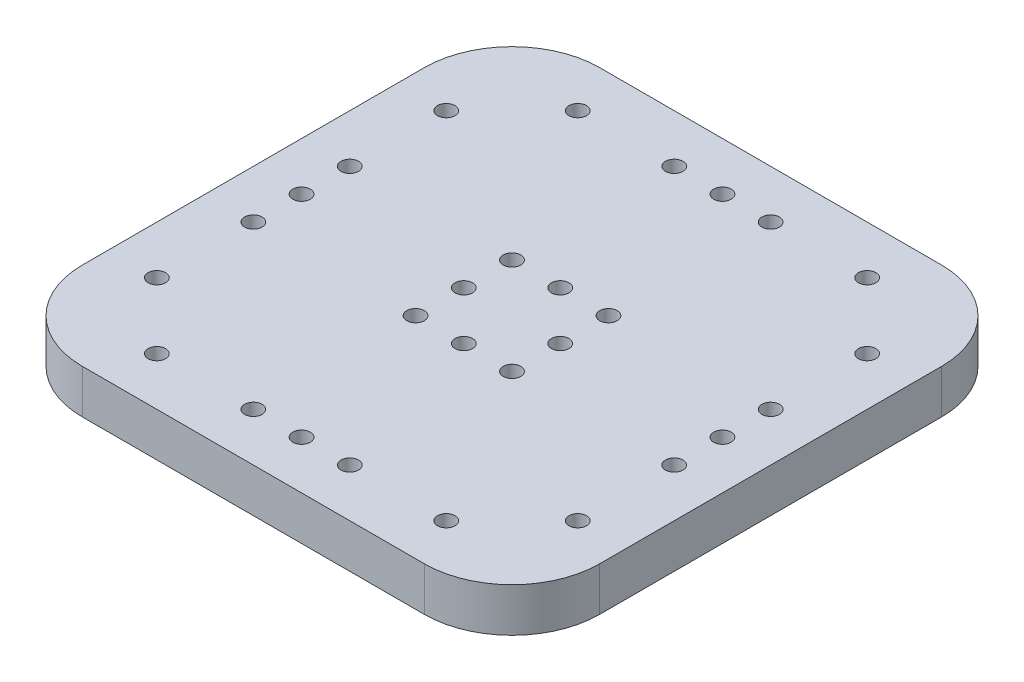
from build123d import *

# Parameters (mm, degrees)
SKETCH1_W           = 118
SKETCH1_H           = 118
SKETCH1_R           = 2
BOSS_EXTRUDE1_DEPTH = 10
FILLET1_R           = 20


with BuildPart() as part:
    # Sketch1 → Boss-Extrude1 (new body)
    with BuildSketch(Plane(origin=(0, 0, 0), x_dir=(1, 0, 0), z_dir=(0, 1, 0))):
        with Locations((-1.371006445, 1.121732546)):
            Rectangle(SKETCH1_W, SKETCH1_H)
        with Locations((-1.371006445, -46.878267454)):
            Circle(SKETCH1_R, mode=Mode.SUBTRACT)
        with Locations((9.628993555, -46.878267454)):
            Circle(SKETCH1_R, mode=Mode.SUBTRACT)
        with Locations((31.628993555, -46.878267454)):
            Circle(SKETCH1_R, mode=Mode.SUBTRACT)
        with Locations((-34.371006445, -46.878267454)):
            Circle(SKETCH1_R, mode=Mode.SUBTRACT)
        with Locations((-12.371006445, -46.878267454)):
            Circle(SKETCH1_R, mode=Mode.SUBTRACT)
        with Locations((-1.371006445, -9.878267454)):
            Circle(SKETCH1_R, mode=Mode.SUBTRACT)
        with Locations((9.628993555, -9.878267454)):
            Circle(SKETCH1_R, mode=Mode.SUBTRACT)
        with Locations((-12.371006445, -9.878267454)):
            Circle(SKETCH1_R, mode=Mode.SUBTRACT)
        with Locations((-12.371006445, 1.121732546)):
            Circle(SKETCH1_R, mode=Mode.SUBTRACT)
        with Locations((-12.371006445, 12.121732546)):
            Circle(SKETCH1_R, mode=Mode.SUBTRACT)
        with Locations((9.628993555, 12.121732546)):
            Circle(SKETCH1_R, mode=Mode.SUBTRACT)
        with Locations((-1.371006445, 12.121732546)):
            Circle(SKETCH1_R, mode=Mode.SUBTRACT)
        with Locations((-12.371006445, 49.121732546)):
            Circle(SKETCH1_R, mode=Mode.SUBTRACT)
        with Locations((-34.371006445, 49.121732546)):
            Circle(SKETCH1_R, mode=Mode.SUBTRACT)
        with Locations((31.628993555, 49.121732546)):
            Circle(SKETCH1_R, mode=Mode.SUBTRACT)
        with Locations((9.628993555, 49.121732546)):
            Circle(SKETCH1_R, mode=Mode.SUBTRACT)
        with Locations((-1.371006445, 49.121732546)):
            Circle(SKETCH1_R, mode=Mode.SUBTRACT)
        with Locations((9.628993555, 1.121732546)):
            Circle(SKETCH1_R, mode=Mode.SUBTRACT)
        with Locations((46.628993555, 12.121732546)):
            Circle(SKETCH1_R, mode=Mode.SUBTRACT)
        with Locations((46.628993555, 34.121732546)):
            Circle(SKETCH1_R, mode=Mode.SUBTRACT)
        with Locations((46.628993555, -31.878267454)):
            Circle(SKETCH1_R, mode=Mode.SUBTRACT)
        with Locations((46.628993555, -9.878267454)):
            Circle(SKETCH1_R, mode=Mode.SUBTRACT)
        with Locations((46.628993555, 1.121732546)):
            Circle(SKETCH1_R, mode=Mode.SUBTRACT)
        with Locations((-49.371006445, 1.121732546)):
            Circle(SKETCH1_R, mode=Mode.SUBTRACT)
        with Locations((-49.371006445, -9.878267454)):
            Circle(SKETCH1_R, mode=Mode.SUBTRACT)
        with Locations((-49.371006445, -31.878267454)):
            Circle(SKETCH1_R, mode=Mode.SUBTRACT)
        with Locations((-49.371006445, 34.121732546)):
            Circle(SKETCH1_R, mode=Mode.SUBTRACT)
        with Locations((-49.371006445, 12.121732546)):
            Circle(SKETCH1_R, mode=Mode.SUBTRACT)
    extrude(amount=BOSS_EXTRUDE1_DEPTH)

    # Fillet1
    fillet1_edges = [part.edges().sort_by_distance(p)[0] for p in [
        (-60.371006445, 5, -60.121732546),
        (57.628993555, 5, -60.121732546),
        (57.628993555, 5, 57.878267454),
        (-60.371006445, 5, 57.878267454),
    ]]
    fillet(fillet1_edges, radius=FILLET1_R)


solid = part.part
